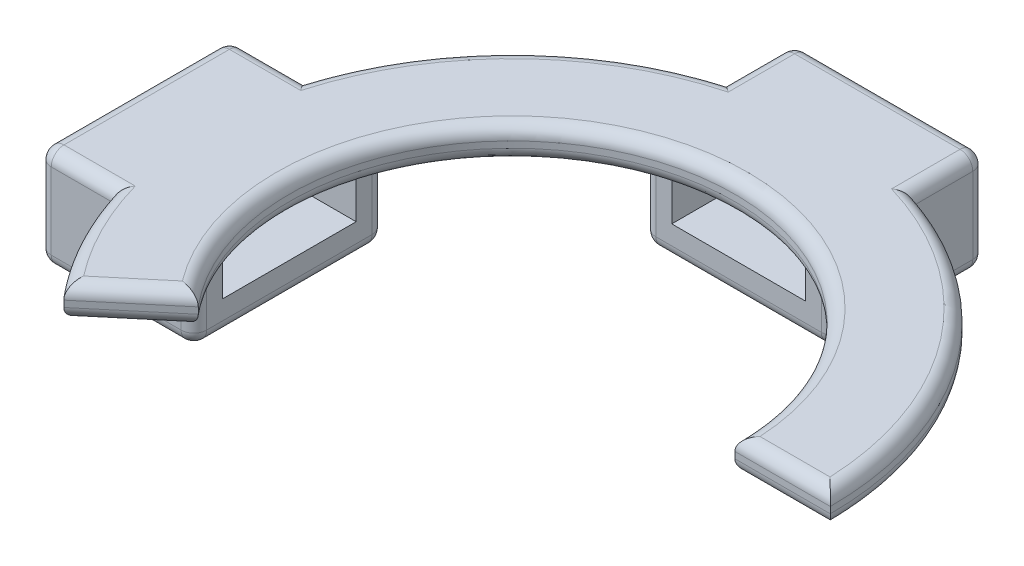
from build123d import *

# Parameters (mm, degrees)
BOSS_EXTRUDE1_DEPTH = 5
BOSS_EXTRUDE2_DEPTH = 5
SKETCH3_W           = 21.364884483
SKETCH3_H           = 30
BOSS_EXTRUDE3_DEPTH = 5
SKETCH4_W           = 4.5
SKETCH4_H           = 23.795279756
SKETCH4_W_2         = 24.409877042
SKETCH4_H_2         = 4.5
BOSS_EXTRUDE4_DEPTH = 11
SKETCH5_W           = 30
SKETCH5_H           = 23.795279756
SKETCH5_W_2         = 24.409877042
SKETCH5_H_2         = 30
BOSS_EXTRUDE5_DEPTH = 5
FILLET1_R           = 2


with BuildPart() as part:
    # Sketch1 → Boss-Extrude1 (new body)
    with BuildSketch(Plane(origin=(0, 0, 0), x_dir=(1, 0, 0), z_dir=(0, 1, 0))):
        with BuildLine():
            Line((-50.590122958, 6.204720244), (-35.590122958, 6.204720244))
            ThreePointArc((-35.590122958, 6.204720244), (-0.590122958, 41.204720244), (34.409877042, 6.204720244))
            Line((34.409877042, 6.204720244), (49.409877042, 6.204720244))
            ThreePointArc((49.409877042, 6.204720244), (-0.590122958, 56.204720244), (-50.590122958, 6.204720244))
        make_face()
        with BuildLine():
            Line((15, 65), (-15, 65))
            Line((-15, 65), (-15, 54.083269132))
            ThreePointArc((-15, 54.083269132), (0.028498674, 56.20089317), (15, 53.71206774))
            Line((15, 53.71206774), (15, 65))
        make_face()
    extrude(amount=BOSS_EXTRUDE1_DEPTH)

    # Sketch2 → Boss-Extrude2 (add)
    with BuildSketch(Plane(origin=(0, 0, 0), x_dir=(1, 0, 0), z_dir=(0, 1, 0))):
        with BuildLine():
            Line((-38.892345114, -25.93466024), (-27.401678467, -16.292846095))
            ThreePointArc((-27.401678467, -16.292846095), (-33.479364685, -5.765984773), (-35.590122958, 6.204720244))
            Line((-35.590122958, 6.204720244), (-50.590122958, 6.204720244))
            ThreePointArc((-50.590122958, 6.204720244), (-47.574753997, -10.896286922), (-38.892345114, -25.93466024))
        make_face()
    extrude(amount=BOSS_EXTRUDE2_DEPTH)

    # Sketch3 → Boss-Extrude3 (add)
    with BuildSketch(Plane(origin=(0, 0, 0), x_dir=(1, 0, 0), z_dir=(0, 1, 0))):
        with Locations((-49.317557759, 6.204720244)):
            Rectangle(SKETCH3_W, SKETCH3_H)
    extrude(amount=BOSS_EXTRUDE3_DEPTH)

    # Sketch4 → Boss-Extrude4 (add)
    with BuildSketch(Plane(origin=(0, 5, 0), x_dir=(1, 0, 0), z_dir=(0, 1, 0))):
        with Locations((-12.75, 53.102360122)):
            Rectangle(SKETCH4_W, SKETCH4_H)
        with Locations((12.75, 53.102360122)):
            Rectangle(SKETCH4_W, SKETCH4_H)
        with Locations((-47.795061479, 18.954720244)):
            Rectangle(SKETCH4_W_2, SKETCH4_H_2)
        with Locations((-47.795061479, -6.545279756)):
            Rectangle(SKETCH4_W_2, SKETCH4_H_2)
    extrude(amount=-BOSS_EXTRUDE4_DEPTH)

    # Sketch5 → Boss-Extrude5 (add)
    with BuildSketch(Plane(origin=(0, -6, 0), x_dir=(-1, 0, 0), z_dir=(0, -1, 0))):
        with Locations((0, 53.102360122)):
            Rectangle(SKETCH5_W, SKETCH5_H)
        with Locations((47.795061479, 6.204720244)):
            Rectangle(SKETCH5_W_2, SKETCH5_H_2)
    extrude(amount=BOSS_EXTRUDE5_DEPTH)

    # Fillet1
    # the kernel refuses this fillet: 2 mm, written as the material it takes off along each edge
    with BuildSketch(Plane(origin=(-37.590122958, -9, -19.204720244), x_dir=(0, 0, -1), z_dir=(1, 0, 0))) as fillet1_piece_1_section:
        Polygon((0, 0), (FILLET1_R * 1.02, 0), (FILLET1_R * 1.02, -FILLET1_R * 1.02), (0, -FILLET1_R * 1.02), align=None)
    fillet1_piece_1 = extrude(amount=FILLET1_R * 1.02, mode=Mode.PRIVATE)
    fillet1_piece_1 = fillet1_piece_1 - Plane(origin=(-37.590122958, -9, -19.204720244), x_dir=(0, 0.7071067811865475, 0.7071067811865475), z_dir=(1, 0, 0)) * Sphere(FILLET1_R, mode=Mode.PRIVATE)
    add(fillet1_piece_1, mode=Mode.SUBTRACT)
    with BuildSketch(Plane(origin=(-37.590122958, -9, 6.795279756), x_dir=(1, 0, 0), z_dir=(0, 0, 1))) as fillet1_piece_2_section:
        Polygon((0, 0), (FILLET1_R * 1.02, 0), (FILLET1_R * 1.02, -FILLET1_R * 1.02), (0, -FILLET1_R * 1.02), align=None)
    fillet1_piece_2 = extrude(amount=FILLET1_R * 1.02, mode=Mode.PRIVATE)
    fillet1_piece_2 = fillet1_piece_2 - Plane(origin=(-37.590122958, -9, 6.795279756), x_dir=(-0.7071067811865475, 0.7071067811865475, 0), z_dir=(0, 0, 1)) * Sphere(FILLET1_R, mode=Mode.PRIVATE)
    add(fillet1_piece_2, mode=Mode.SUBTRACT)
    with BuildSketch(Plane(origin=(-13, -9, -43.204720244), x_dir=(-1, 0, 0), z_dir=(0, 0, 1))) as fillet1_piece_3_section:
        Polygon((0, 0), (FILLET1_R * 1.02, 0), (FILLET1_R * 1.02, FILLET1_R * 1.02), (0, FILLET1_R * 1.02), align=None)
    fillet1_piece_3 = extrude(amount=FILLET1_R * 1.02, mode=Mode.PRIVATE)
    fillet1_piece_3 = fillet1_piece_3 - Plane(origin=(-13, -9, -43.204720244), x_dir=(0.7071067811865475, 0.7071067811865475, 0), z_dir=(0, 0, 1)) * Sphere(FILLET1_R, mode=Mode.PRIVATE)
    add(fillet1_piece_3, mode=Mode.SUBTRACT)
    with BuildSketch(Plane(origin=(-13, -9, -63), x_dir=(0, -1, 0), z_dir=(-1, 0, 0))) as fillet1_piece_4_section:
        Polygon((0, 0), (FILLET1_R * 1.02, 0), (FILLET1_R * 1.02, -FILLET1_R * 1.02), (0, -FILLET1_R * 1.02), align=None)
    fillet1_piece_4 = extrude(amount=FILLET1_R * 1.02, mode=Mode.PRIVATE)
    fillet1_piece_4 = fillet1_piece_4 - Plane(origin=(-13, -9, -63), x_dir=(0, 0.7071067811865475, 0.7071067811865475), z_dir=(-1, 0, 0)) * Sphere(FILLET1_R, mode=Mode.PRIVATE)
    add(fillet1_piece_4, mode=Mode.SUBTRACT)
    with BuildSketch(Plane(origin=(13, -9, -63), x_dir=(1, 0, 0), z_dir=(0, -1, 0))) as fillet1_piece_5_section:
        Polygon((0, 0), (FILLET1_R * 1.02, 0), (FILLET1_R * 1.02, -FILLET1_R * 1.02), (0, -FILLET1_R * 1.02), align=None)
    fillet1_piece_5 = extrude(amount=FILLET1_R * 1.02, mode=Mode.PRIVATE)
    fillet1_piece_5 = fillet1_piece_5 - Plane(origin=(13, -9, -63), x_dir=(-0.7071067811865475, 0, 0.7071067811865475), z_dir=(0, -1, 0)) * Sphere(FILLET1_R, mode=Mode.PRIVATE)
    add(fillet1_piece_5, mode=Mode.SUBTRACT)
    with BuildSketch(Plane(origin=(13, -9, -43.204720244), x_dir=(0, -1, 0), z_dir=(0, 0, 1))) as fillet1_piece_6_section:
        Polygon((0, 0), (FILLET1_R * 1.02, 0), (FILLET1_R * 1.02, FILLET1_R * 1.02), (0, FILLET1_R * 1.02), align=None)
    fillet1_piece_6 = extrude(amount=FILLET1_R * 1.02, mode=Mode.PRIVATE)
    fillet1_piece_6 = fillet1_piece_6 - Plane(origin=(13, -9, -43.204720244), x_dir=(-0.7071067811865475, 0.7071067811865475, 0), z_dir=(0, 0, 1)) * Sphere(FILLET1_R, mode=Mode.PRIVATE)
    add(fillet1_piece_6, mode=Mode.SUBTRACT)
    with BuildSketch(Plane(origin=(-58, -9, 6.795279756), x_dir=(0, -1, 0), z_dir=(0, 0, 1))) as fillet1_piece_7_section:
        Polygon((0, 0), (FILLET1_R * 1.02, 0), (FILLET1_R * 1.02, -FILLET1_R * 1.02), (0, -FILLET1_R * 1.02), align=None)
    fillet1_piece_7 = extrude(amount=FILLET1_R * 1.02, mode=Mode.PRIVATE)
    fillet1_piece_7 = fillet1_piece_7 - Plane(origin=(-58, -9, 6.795279756), x_dir=(0.7071067811865475, 0.7071067811865475, 0), z_dir=(0, 0, 1)) * Sphere(FILLET1_R, mode=Mode.PRIVATE)
    add(fillet1_piece_7, mode=Mode.SUBTRACT)
    with BuildSketch(Plane(origin=(-58, -9, -19.204720244), x_dir=(0, -1, 0), z_dir=(0, 0, -1))) as fillet1_piece_8_section:
        Polygon((0, 0), (FILLET1_R * 1.02, 0), (FILLET1_R * 1.02, FILLET1_R * 1.02), (0, FILLET1_R * 1.02), align=None)
    fillet1_piece_8 = extrude(amount=FILLET1_R * 1.02, mode=Mode.PRIVATE)
    fillet1_piece_8 = fillet1_piece_8 - Plane(origin=(-58, -9, -19.204720244), x_dir=(0.7071067811865475, 0.7071067811865475, 0), z_dir=(0, 0, -1)) * Sphere(FILLET1_R, mode=Mode.PRIVATE)
    add(fillet1_piece_8, mode=Mode.SUBTRACT)
    with BuildSketch(Plane(origin=(-13, 3, -63), x_dir=(0, 0, -1), z_dir=(-1, 0, 0))) as fillet1_piece_9_section:
        Polygon((0, 0), (FILLET1_R * 1.02, 0), (FILLET1_R * 1.02, -FILLET1_R * 1.02), (0, -FILLET1_R * 1.02), align=None)
    fillet1_piece_9 = extrude(amount=FILLET1_R * 1.02, mode=Mode.PRIVATE)
    fillet1_piece_9 = fillet1_piece_9 - Plane(origin=(-13, 3, -63), x_dir=(0, -0.7071067811865475, 0.7071067811865475), z_dir=(-1, 0, 0)) * Sphere(FILLET1_R, mode=Mode.PRIVATE)
    add(fillet1_piece_9, mode=Mode.SUBTRACT)
    with BuildSketch(Plane(origin=(13, 3, -63), x_dir=(0, 0, -1), z_dir=(1, 0, 0))) as fillet1_piece_10_section:
        Polygon((0, 0), (FILLET1_R * 1.02, 0), (FILLET1_R * 1.02, FILLET1_R * 1.02), (0, FILLET1_R * 1.02), align=None)
    fillet1_piece_10 = extrude(amount=FILLET1_R * 1.02, mode=Mode.PRIVATE)
    fillet1_piece_10 = fillet1_piece_10 - Plane(origin=(13, 3, -63), x_dir=(0, -0.7071067811865475, 0.7071067811865475), z_dir=(1, 0, 0)) * Sphere(FILLET1_R, mode=Mode.PRIVATE)
    add(fillet1_piece_10, mode=Mode.SUBTRACT)
    with BuildSketch(Plane(origin=(-58, 3, -19.204720244), x_dir=(0, 0, -1), z_dir=(0, 1, 0))) as fillet1_piece_11_section:
        Polygon((0, 0), (FILLET1_R * 1.02, 0), (FILLET1_R * 1.02, FILLET1_R * 1.02), (0, FILLET1_R * 1.02), align=None)
    fillet1_piece_11 = extrude(amount=FILLET1_R * 1.02, mode=Mode.PRIVATE)
    fillet1_piece_11 = fillet1_piece_11 - Plane(origin=(-58, 3, -19.204720244), x_dir=(0.7071067811865476, 0, 0.7071067811865475), z_dir=(0, 1, 0)) * Sphere(FILLET1_R, mode=Mode.PRIVATE)
    add(fillet1_piece_11, mode=Mode.SUBTRACT)
    with BuildSketch(Plane(origin=(-58, 3, 6.795279756), x_dir=(0, 1, 0), z_dir=(0, 0, 1))) as fillet1_piece_12_section:
        Polygon((0, 0), (FILLET1_R * 1.02, 0), (FILLET1_R * 1.02, FILLET1_R * 1.02), (0, FILLET1_R * 1.02), align=None)
    fillet1_piece_12 = extrude(amount=FILLET1_R * 1.02, mode=Mode.PRIVATE)
    fillet1_piece_12 = fillet1_piece_12 - Plane(origin=(-58, 3, 6.795279756), x_dir=(0.7071067811865475, -0.7071067811865475, 0), z_dir=(0, 0, 1)) * Sphere(FILLET1_R, mode=Mode.PRIVATE)
    add(fillet1_piece_12, mode=Mode.SUBTRACT)
    with BuildSketch(Plane(origin=(-35.590122958, 0, -21.204720244), x_dir=(0, 0, 1), z_dir=(0, -1, 0)), Plane(origin=(15, -9, -41.204720244), x_dir=(0, 0, -1), z_dir=(0, 1, 0))) as fillet1_piece_13:
        with BuildLine():
            CenterArc((FILLET1_R, FILLET1_R), FILLET1_R, 180, 90)
            Line((0, FILLET1_R), (0, 0))
            Line((0, 0), (FILLET1_R, 0))
        make_face()
    extrude(amount=9, mode=Mode.SUBTRACT)
    with BuildSketch(Plane(origin=(-0.590122958, 0, -6.204720244), x_dir=(0.9950016105193895, 0, 0.09985887573881982), z_dir=(-0.09985887573881982, 0, 0.9950016105193895))) as fillet1_piece_14_section:
        with BuildLine():
            CenterArc((50 - FILLET1_R, FILLET1_R), FILLET1_R, 270, 90)
            Line((50 - FILLET1_R, 0), (50, 0))
            Line((50, 0), (50, FILLET1_R))
        make_face()
    fillet1_piece_14 = revolve(axis=Axis((-0.590122958, 0, -6.204720244), (0, 1, 0)), revolution_arc=83.29419928, mode=Mode.PRIVATE)
    fillet1_piece_14 = split(fillet1_piece_14, bisect_by=Plane(origin=(15, 0, -6.204720244), z_dir=(1, 0, 0)), keep=Keep.TOP, mode=Mode.PRIVATE)
    add(fillet1_piece_14, mode=Mode.SUBTRACT)
    with BuildSketch(Plane(origin=(29.409877042, 0, -6.204720244), x_dir=(0, 1, 0), z_dir=(1, 0, 0)), Plane(origin=(-42.722567329, 0, 29.148598289), x_dir=(0, 1, 0), z_dir=(0.7660444431189779, 0, -0.6427876096865396))) as fillet1_piece_15:
        with BuildLine():
            CenterArc((FILLET1_R, -FILLET1_R), FILLET1_R, 90, 90)
            Line((0, -FILLET1_R), (0, 0))
            Line((0, 0), (FILLET1_R, 0))
        make_face()
    extrude(amount=25, mode=Mode.SUBTRACT)
    with BuildSketch(Plane(origin=(-35.590122958, -9, 8.795279756), x_dir=(-1, 0, 0), z_dir=(0, 1, 0)), Plane(origin=(-15, -9, -41.204720244), x_dir=(0, 0, -1), z_dir=(0, 1, 0))) as fillet1_piece_16:
        with BuildLine():
            CenterArc((FILLET1_R, -FILLET1_R), FILLET1_R, 90, 90)
            Line((0, -FILLET1_R), (0, 0))
            Line((0, 0), (FILLET1_R, 0))
        make_face()
    extrude(amount=9, mode=Mode.SUBTRACT)
    with BuildSketch(Plane(origin=(29.409877042, 5, -6.204720244), x_dir=(0, -1, 0), z_dir=(1, 0, 0)), Plane(origin=(-42.722567329, 5, 29.148598289), x_dir=(0, -1, 0), z_dir=(0.7660444431189779, 0, -0.6427876096865396))) as fillet1_piece_17:
        with BuildLine():
            CenterArc((FILLET1_R, FILLET1_R), FILLET1_R, 180, 90)
            Line((0, FILLET1_R), (0, 0))
            Line((0, 0), (FILLET1_R, 0))
        make_face()
    extrude(amount=25, mode=Mode.SUBTRACT)
    with BuildSketch(Plane(origin=(-0.590122958, 0, -6.204720244), x_dir=(0.989764313827561, 0, 0.14271160805434607), z_dir=(-0.14271160805434607, 0, 0.989764313827561))) as fillet1_piece_18_section:
        with BuildLine():
            CenterArc((35 + FILLET1_R, FILLET1_R), FILLET1_R, 180, 90)
            Line((35 + FILLET1_R, 0), (35, 0))
            Line((35, 0), (35, FILLET1_R))
        make_face()
    fillet1_piece_18 = revolve(axis=Axis((-0.590122958, 0, -6.204720244), (0, 1, 0)), revolution_arc=236.409571698, mode=Mode.PRIVATE)
    fillet1_piece_18 = split(fillet1_piece_18, bisect_by=Plane(origin=(-35.590122958, 0, -6.204720244), z_dir=(1, 0, 0)), keep=Keep.TOP, mode=Mode.PRIVATE)
    fillet1_piece_18 = split(fillet1_piece_18, bisect_by=Plane(origin=(-0.590122958, 0, -41.204720244), z_dir=(0, 0, 1)), keep=Keep.TOP, mode=Mode.PRIVATE)
    add(fillet1_piece_18, mode=Mode.SUBTRACT)
    with BuildSketch(Plane(origin=(-0.590122958, 0, -6.204720244), x_dir=(0.989764313827561, 0, 0.14271160805434607), z_dir=(-0.14271160805434607, 0, 0.989764313827561))) as fillet1_piece_19_section:
        with BuildLine():
            CenterArc((35 + FILLET1_R, FILLET1_R), FILLET1_R, 180, 90)
            Line((35 + FILLET1_R, 0), (35, 0))
            Line((35, 0), (35, FILLET1_R))
        make_face()
    fillet1_piece_19 = revolve(axis=Axis((-0.590122958, 0, -6.204720244), (0, 1, 0)), revolution_arc=236.409571698, mode=Mode.PRIVATE)
    fillet1_piece_19 = split(fillet1_piece_19, bisect_by=Plane(origin=(10.5, 0, -6.204720244), z_dir=(-1, 0, 0)), keep=Keep.TOP, mode=Mode.PRIVATE)
    fillet1_piece_19 = split(fillet1_piece_19, bisect_by=Plane(origin=(-10.5, 0, -6.204720244), z_dir=(1, 0, 0)), keep=Keep.TOP, mode=Mode.PRIVATE)
    add(fillet1_piece_19, mode=Mode.SUBTRACT)
    with BuildSketch(Plane(origin=(-0.590122958, 0, -6.204720244), x_dir=(0.989764313827561, 0, 0.14271160805434607), z_dir=(-0.14271160805434607, 0, 0.989764313827561))) as fillet1_piece_20_section:
        with BuildLine():
            CenterArc((35 + FILLET1_R, FILLET1_R), FILLET1_R, 180, 90)
            Line((35 + FILLET1_R, 0), (35, 0))
            Line((35, 0), (35, FILLET1_R))
        make_face()
    fillet1_piece_20 = revolve(axis=Axis((-0.590122958, 0, -6.204720244), (0, 1, 0)), revolution_arc=236.409571698, mode=Mode.PRIVATE)
    fillet1_piece_20 = split(fillet1_piece_20, bisect_by=Plane(origin=(-0.590122958, 0, 4.295279756), z_dir=(0, 0, -1)), keep=Keep.TOP, mode=Mode.PRIVATE)
    fillet1_piece_20 = split(fillet1_piece_20, bisect_by=Plane(origin=(-0.590122958, 0, -16.704720244), z_dir=(0, 0, 1)), keep=Keep.TOP, mode=Mode.PRIVATE)
    add(fillet1_piece_20, mode=Mode.SUBTRACT)
    with BuildSketch(Plane(origin=(-15, -11, -43.204720244), x_dir=(0, 1, 0), z_dir=(0, 0, -1))) as fillet1_piece_21:
        with BuildLine():
            CenterArc((FILLET1_R, FILLET1_R), FILLET1_R, 180, 90)
            Line((0, FILLET1_R), (0, 0))
            Line((0, 0), (FILLET1_R, 0))
        make_face()
    extrude(amount=19.795279756, mode=Mode.SUBTRACT)
    with BuildSketch(Plane(origin=(-13, -11, -65), x_dir=(0, 0, 1), z_dir=(1, 0, 0)), Plane(origin=(13, -11, -41.204720244), x_dir=(0, 0, -1), z_dir=(-1, 0, 0)), Plane(origin=(-60, -11, 6.795279756), x_dir=(1, 0, 0), z_dir=(0, 0, -1))) as fillet1_piece_22:
        with BuildLine():
            CenterArc((FILLET1_R, -FILLET1_R), FILLET1_R, 90, 90)
            Line((0, -FILLET1_R), (0, 0))
            Line((0, 0), (FILLET1_R, 0))
        make_face()
    extrude(amount=26, mode=Mode.SUBTRACT)
    with BuildSketch(Plane(origin=(15, -11, -63), x_dir=(-1, 0, 0), z_dir=(0, 0, 1))) as fillet1_piece_23:
        with BuildLine():
            CenterArc((FILLET1_R, -FILLET1_R), FILLET1_R, 90, 90)
            Line((0, -FILLET1_R), (0, 0))
            Line((0, 0), (FILLET1_R, 0))
        make_face()
    extrude(amount=19.795279756, mode=Mode.SUBTRACT)
    with BuildSketch(Plane(origin=(-58, -11, -21.204720244), x_dir=(0, 0, 1), z_dir=(1, 0, 0))) as fillet1_piece_24:
        with BuildLine():
            CenterArc((FILLET1_R, -FILLET1_R), FILLET1_R, 90, 90)
            Line((0, -FILLET1_R), (0, 0))
            Line((0, 0), (FILLET1_R, 0))
        make_face()
    extrude(amount=20.409877042, mode=Mode.SUBTRACT)
    with BuildSketch(Plane(origin=(-35.590122958, -11, -19.204720244), x_dir=(0, 1, 0), z_dir=(0, 0, 1)), Plane(origin=(13, 5, -65), x_dir=(0, -1, 0), z_dir=(-1, 0, 0)), Plane(origin=(-60, 5, -19.204720244), x_dir=(0, -1, 0), z_dir=(0, 0, 1))) as fillet1_piece_25:
        with BuildLine():
            CenterArc((FILLET1_R, FILLET1_R), FILLET1_R, 180, 90)
            Line((0, FILLET1_R), (0, 0))
            Line((0, 0), (FILLET1_R, 0))
        make_face()
    extrude(amount=26, mode=Mode.SUBTRACT)
    with BuildSketch(Plane(origin=(-37.590122958, -11, 8.795279756), x_dir=(0, 1, 0), z_dir=(-1, 0, 0))) as fillet1_piece_26:
        with BuildLine():
            CenterArc((FILLET1_R, FILLET1_R), FILLET1_R, 180, 90)
            Line((0, FILLET1_R), (0, 0))
            Line((0, 0), (FILLET1_R, 0))
        make_face()
    extrude(amount=20.409877042, mode=Mode.SUBTRACT)
    with BuildSketch(Plane(origin=(-15, 3, -65), x_dir=(0, 0, 1), z_dir=(0, -1, 0)), Plane(origin=(-60, 3, 8.795279756), x_dir=(1, 0, 0), z_dir=(0, -1, 0))) as fillet1_piece_27:
        with BuildLine():
            CenterArc((FILLET1_R, -FILLET1_R), FILLET1_R, 90, 90)
            Line((0, -FILLET1_R), (0, 0))
            Line((0, 0), (FILLET1_R, 0))
        make_face()
    extrude(amount=12, mode=Mode.SUBTRACT)
    with BuildSketch(Plane(origin=(15, 3, -65), x_dir=(0, 0, 1), z_dir=(0, -1, 0)), Plane(origin=(-60, -9, -21.204720244), x_dir=(0, 0, 1), z_dir=(0, 1, 0))) as fillet1_piece_28:
        with BuildLine():
            CenterArc((FILLET1_R, FILLET1_R), FILLET1_R, 180, 90)
            Line((0, FILLET1_R), (0, 0))
            Line((0, 0), (FILLET1_R, 0))
        make_face()
    extrude(amount=12, mode=Mode.SUBTRACT)
    with BuildSketch(Plane(origin=(-0.590122958, 5, -6.204720244), x_dir=(0.9950016105193895, 0, 0.09985887573881982), z_dir=(-0.09985887573881982, 0, 0.9950016105193895))) as fillet1_piece_29_section:
        with BuildLine():
            CenterArc((50 - FILLET1_R, -FILLET1_R), FILLET1_R, 0, 90)
            Line((50 - FILLET1_R, 0), (50, 0))
            Line((50, 0), (50, -FILLET1_R))
        make_face()
    fillet1_piece_29 = revolve(axis=Axis((-0.590122958, 5, -6.204720244), (0, 1, 0)), revolution_arc=83.29419928, mode=Mode.PRIVATE)
    fillet1_piece_29 = split(fillet1_piece_29, bisect_by=Plane(origin=(15, 5, -6.204720244), z_dir=(1, 0, 0)), keep=Keep.TOP, mode=Mode.PRIVATE)
    add(fillet1_piece_29, mode=Mode.SUBTRACT)
    with BuildSketch(Plane(origin=(15, 5, -48.71206774), x_dir=(0, -1, 0), z_dir=(0, 0, -1))) as fillet1_piece_30_section:
        with BuildLine():
            CenterArc((FILLET1_R, FILLET1_R), FILLET1_R, 180, 90)
            Line((0, FILLET1_R), (0, 0))
            Line((0, 0), (FILLET1_R, 0))
        make_face()
    fillet1_piece_30 = extrude(amount=14.28793226, mode=Mode.PRIVATE)
    fillet1_piece_30 = fillet1_piece_30 - Plane(origin=(-0.590122958, 5, -6.204720244), x_dir=(1, 0, 0), z_dir=(0, -1, 0)) * Cylinder(50, 37, mode=Mode.PRIVATE)
    add(fillet1_piece_30, mode=Mode.SUBTRACT)
    with BuildSketch(Plane(origin=(-15, 5, -63), x_dir=(0, -1, 0), z_dir=(0, 0, 1))) as fillet1_piece_31_section:
        with BuildLine():
            CenterArc((FILLET1_R, FILLET1_R), FILLET1_R, 180, 90)
            Line((0, FILLET1_R), (0, 0))
            Line((0, 0), (FILLET1_R, 0))
        make_face()
    fillet1_piece_31 = extrude(amount=13.916730868, mode=Mode.PRIVATE)
    fillet1_piece_31 = fillet1_piece_31 - Plane(origin=(-0.590122958, 5, -6.204720244), x_dir=(1, 0, 0), z_dir=(0, -1, 0)) * Cylinder(50, 36, mode=Mode.PRIVATE)
    add(fillet1_piece_31, mode=Mode.SUBTRACT)
    with BuildSketch(Plane(origin=(-0.590122958, 5, -6.204720244), x_dir=(-0.9791240159485516, 0, 0.2032637729473219), z_dir=(-0.2032637729473219, 0, -0.9791240159485516))) as fillet1_piece_32_section:
        with BuildLine():
            CenterArc((50 - FILLET1_R, -FILLET1_R), FILLET1_R, 0, 90)
            Line((50 - FILLET1_R, 0), (50, 0))
            Line((50, 0), (50, -FILLET1_R))
        make_face()
    fillet1_piece_32 = revolve(axis=Axis((-0.590122958, 5, -6.204720244), (0, 1, 0)), revolution_arc=34.00184149, mode=Mode.PRIVATE)
    fillet1_piece_32 = split(fillet1_piece_32, bisect_by=Plane(origin=(-0.590122958, 5, 8.795279756), z_dir=(0, 0, 1)), keep=Keep.TOP, mode=Mode.PRIVATE)
    add(fillet1_piece_32, mode=Mode.SUBTRACT)
    with BuildSketch(Plane(origin=(-0.590122958, 0, -6.204720244), x_dir=(-0.19114502104221412, 0, -0.9815618069845482), z_dir=(0.9815618069845482, 0, -0.19114502104221412))) as fillet1_piece_33_section:
        with BuildLine():
            CenterArc((50 - FILLET1_R, FILLET1_R), FILLET1_R, 270, 90)
            Line((50 - FILLET1_R, 0), (50, 0))
            Line((50, 0), (50, FILLET1_R))
        make_face()
    fillet1_piece_33 = revolve(axis=Axis((-0.590122958, 0, -6.204720244), (0, 1, 0)), revolution_arc=67.253245318, mode=Mode.PRIVATE)
    fillet1_piece_33 = split(fillet1_piece_33, bisect_by=Plane(origin=(-15, 0, -6.204720244), z_dir=(-1, 0, 0)), keep=Keep.TOP, mode=Mode.PRIVATE)
    fillet1_piece_33 = split(fillet1_piece_33, bisect_by=Plane(origin=(-0.590122958, 0, -21.204720244), z_dir=(0, 0, -1)), keep=Keep.TOP, mode=Mode.PRIVATE)
    add(fillet1_piece_33, mode=Mode.SUBTRACT)
    with BuildSketch(Plane(origin=(-0.590122958, 5, -6.204720244), x_dir=(-0.19114502104221412, 0, -0.9815618069845482), z_dir=(0.9815618069845482, 0, -0.19114502104221412))) as fillet1_piece_34_section:
        with BuildLine():
            CenterArc((50 - FILLET1_R, -FILLET1_R), FILLET1_R, 0, 90)
            Line((50 - FILLET1_R, 0), (50, 0))
            Line((50, 0), (50, -FILLET1_R))
        make_face()
    fillet1_piece_34 = revolve(axis=Axis((-0.590122958, 5, -6.204720244), (0, 1, 0)), revolution_arc=67.253245318, mode=Mode.PRIVATE)
    fillet1_piece_34 = split(fillet1_piece_34, bisect_by=Plane(origin=(-15, 5, -6.204720244), z_dir=(-1, 0, 0)), keep=Keep.TOP, mode=Mode.PRIVATE)
    fillet1_piece_34 = split(fillet1_piece_34, bisect_by=Plane(origin=(-0.590122958, 5, -21.204720244), z_dir=(0, 0, -1)), keep=Keep.TOP, mode=Mode.PRIVATE)
    add(fillet1_piece_34, mode=Mode.SUBTRACT)
    with BuildSketch(Plane(origin=(-43.287083029, 5, 8.795279756), x_dir=(0, -1, 0), z_dir=(-1, 0, 0))) as fillet1_piece_35_section:
        with BuildLine():
            CenterArc((FILLET1_R, -FILLET1_R), FILLET1_R, 90, 90)
            Line((0, -FILLET1_R), (0, 0))
            Line((0, 0), (FILLET1_R, 0))
        make_face()
    fillet1_piece_35 = extrude(amount=14.712916971, mode=Mode.PRIVATE)
    fillet1_piece_35 = fillet1_piece_35 - Plane(origin=(-0.590122958, 5, -6.204720244), x_dir=(1, 0, 0), z_dir=(0, -1, 0)) * Cylinder(50, 38, mode=Mode.PRIVATE)
    add(fillet1_piece_35, mode=Mode.SUBTRACT)
    with BuildSketch(Plane(origin=(-58, 5, -21.204720244), x_dir=(0, 0, 1), z_dir=(1, 0, 0))) as fillet1_piece_36_section:
        with BuildLine():
            CenterArc((FILLET1_R, FILLET1_R), FILLET1_R, 180, 90)
            Line((0, FILLET1_R), (0, 0))
            Line((0, 0), (FILLET1_R, 0))
        make_face()
    fillet1_piece_36 = extrude(amount=14.712916971, mode=Mode.PRIVATE)
    fillet1_piece_36 = fillet1_piece_36 - Plane(origin=(-0.590122958, 5, -6.204720244), x_dir=(1, 0, 0), z_dir=(0, -1, 0)) * Cylinder(50, 38, mode=Mode.PRIVATE)
    add(fillet1_piece_36, mode=Mode.SUBTRACT)
    with BuildSketch(Plane(origin=(-0.590122958, 5, -6.204720244), x_dir=(-0.6664701991892941, 0, 0.7455316717568629), z_dir=(0.7455316717568629, 0, 0.6664701991892941))) as fillet1_piece_37:
        with BuildLine():
            CenterArc((35 + FILLET1_R, FILLET1_R), FILLET1_R, 180, 90)
            Line((35 + FILLET1_R, 0), (35, 0))
            Line((35, 0), (35, FILLET1_R))
        make_face()
    revolve(axis=Axis((-0.590122958, 5, -6.204720244), (0, -1, 0)), revolution_arc=236.409571698, mode=Mode.SUBTRACT)
    with BuildSketch(Plane(origin=(-0.590122958, 0, -6.204720244), x_dir=(-0.9791240159485516, 0, 0.2032637729473219), z_dir=(-0.2032637729473219, 0, -0.9791240159485516))) as fillet1_piece_38_section:
        with BuildLine():
            CenterArc((50 - FILLET1_R, FILLET1_R), FILLET1_R, 270, 90)
            Line((50 - FILLET1_R, 0), (50, 0))
            Line((50, 0), (50, FILLET1_R))
        make_face()
    fillet1_piece_38 = revolve(axis=Axis((-0.590122958, 0, -6.204720244), (0, 1, 0)), revolution_arc=34.00184149, mode=Mode.PRIVATE)
    fillet1_piece_38 = split(fillet1_piece_38, bisect_by=Plane(origin=(-0.590122958, 0, 8.795279756), z_dir=(0, 0, 1)), keep=Keep.TOP, mode=Mode.PRIVATE)
    add(fillet1_piece_38, mode=Mode.SUBTRACT)
    with BuildSketch(Plane(origin=(15, 5, -48.71206774), x_dir=(0, -1, 0), z_dir=(0, 0, -1))) as fillet1_piece_39a_section:
        with BuildLine():
            CenterArc((FILLET1_R, FILLET1_R), FILLET1_R, 180, 90)
            Line((0, FILLET1_R), (0, 0))
            Line((0, 0), (FILLET1_R, 0))
        make_face()
    fillet1_piece_39a = extrude(amount=14.28793226, mode=Mode.PRIVATE)
    fillet1_piece_39a = fillet1_piece_39a & Plane(origin=(-0.590122958, 5, -6.204720244), x_dir=(1, 0, 0), z_dir=(0, -1, 0)) * Cylinder(50, 37, mode=Mode.PRIVATE)
    with BuildSketch(Plane(origin=(-0.590122958, 5, -6.204720244), x_dir=(1, 0, 0), z_dir=(0, 0, 1))) as fillet1_piece_39b_section:
        with BuildLine():
            CenterArc((50 - FILLET1_R, -FILLET1_R), FILLET1_R, 0, 90)
            Line((50 - FILLET1_R, 0), (50, 0))
            Line((50, 0), (50, -FILLET1_R))
        make_face()
    fillet1_piece_39b = revolve(axis=Axis((-0.590122958, 5, -6.204720244), (0, 1, 0)), revolution_arc=77.563155305, mode=Mode.PRIVATE)
    fillet1_piece_39b = split(fillet1_piece_39b, bisect_by=Plane(origin=(15, 5, -6.204720244), z_dir=(-1, 0, 0)), keep=Keep.TOP, mode=Mode.PRIVATE)
    fillet1_piece_39 = fillet1_piece_39a & fillet1_piece_39b
    add(fillet1_piece_39, mode=Mode.SUBTRACT)
    with BuildSketch(Plane(origin=(-0.590122958, 5, -6.204720244), x_dir=(-0.19114502104221412, 0, -0.9815618069845482), z_dir=(0.9815618069845482, 0, -0.19114502104221412))) as fillet1_piece_40a_section:
        with BuildLine():
            CenterArc((50 - FILLET1_R, -FILLET1_R), FILLET1_R, 0, 90)
            Line((50 - FILLET1_R, 0), (50, 0))
            Line((50, 0), (50, -FILLET1_R))
        make_face()
    fillet1_piece_40a = revolve(axis=Axis((-0.590122958, 5, -6.204720244), (0, 1, 0)), revolution_arc=67.253245318, mode=Mode.PRIVATE)
    fillet1_piece_40a = split(fillet1_piece_40a, bisect_by=Plane(origin=(-15, 5, -6.204720244), z_dir=(1, 0, 0)), keep=Keep.TOP, mode=Mode.PRIVATE)
    with BuildSketch(Plane(origin=(-15, 5, -63), x_dir=(0, -1, 0), z_dir=(0, 0, 1))) as fillet1_piece_40b_section:
        with BuildLine():
            CenterArc((FILLET1_R, FILLET1_R), FILLET1_R, 180, 90)
            Line((0, FILLET1_R), (0, 0))
            Line((0, 0), (FILLET1_R, 0))
        make_face()
    fillet1_piece_40b = extrude(amount=13.916730868, mode=Mode.PRIVATE)
    fillet1_piece_40b = fillet1_piece_40b & Plane(origin=(-0.590122958, 5, -6.204720244), x_dir=(1, 0, 0), z_dir=(0, -1, 0)) * Cylinder(50, 36, mode=Mode.PRIVATE)
    fillet1_piece_40 = fillet1_piece_40a & fillet1_piece_40b
    add(fillet1_piece_40, mode=Mode.SUBTRACT)
    with BuildSketch(Plane(origin=(-0.590122958, 5, -6.204720244), x_dir=(-0.9791240159485516, 0, 0.2032637729473219), z_dir=(-0.2032637729473219, 0, -0.9791240159485516))) as fillet1_piece_41a_section:
        with BuildLine():
            CenterArc((50 - FILLET1_R, -FILLET1_R), FILLET1_R, 0, 90)
            Line((50 - FILLET1_R, 0), (50, 0))
            Line((50, 0), (50, -FILLET1_R))
        make_face()
    fillet1_piece_41a = revolve(axis=Axis((-0.590122958, 5, -6.204720244), (0, 1, 0)), revolution_arc=28.272119183, mode=Mode.PRIVATE)
    fillet1_piece_41a = split(fillet1_piece_41a, bisect_by=Plane(origin=(-0.590122958, 5, 8.795279756), z_dir=(0, 0, -1)), keep=Keep.TOP, mode=Mode.PRIVATE)
    with BuildSketch(Plane(origin=(-43.287083029, 5, 8.795279756), x_dir=(0, -1, 0), z_dir=(-1, 0, 0))) as fillet1_piece_41b_section:
        with BuildLine():
            CenterArc((FILLET1_R, -FILLET1_R), FILLET1_R, 90, 90)
            Line((0, -FILLET1_R), (0, 0))
            Line((0, 0), (FILLET1_R, 0))
        make_face()
    fillet1_piece_41b = extrude(amount=14.712916971, mode=Mode.PRIVATE)
    fillet1_piece_41b = fillet1_piece_41b & Plane(origin=(-0.590122958, 5, -6.204720244), x_dir=(1, 0, 0), z_dir=(0, -1, 0)) * Cylinder(50, 38, mode=Mode.PRIVATE)
    fillet1_piece_41 = fillet1_piece_41a & fillet1_piece_41b
    add(fillet1_piece_41, mode=Mode.SUBTRACT)
    with BuildSketch(Plane(origin=(-0.590122958, 5, -6.204720244), x_dir=(-0.19114502104221412, 0, -0.9815618069845482), z_dir=(0.9815618069845482, 0, -0.19114502104221412))) as fillet1_piece_42a_section:
        with BuildLine():
            CenterArc((50 - FILLET1_R, -FILLET1_R), FILLET1_R, 0, 90)
            Line((50 - FILLET1_R, 0), (50, 0))
            Line((50, 0), (50, -FILLET1_R))
        make_face()
    fillet1_piece_42a = revolve(axis=Axis((-0.590122958, 5, -6.204720244), (0, 1, 0)), revolution_arc=67.253245318, mode=Mode.PRIVATE)
    fillet1_piece_42a = split(fillet1_piece_42a, bisect_by=Plane(origin=(-0.590122958, 5, -21.204720244), z_dir=(0, 0, 1)), keep=Keep.TOP, mode=Mode.PRIVATE)
    with BuildSketch(Plane(origin=(-58, 5, -21.204720244), x_dir=(0, 0, 1), z_dir=(1, 0, 0))) as fillet1_piece_42b_section:
        with BuildLine():
            CenterArc((FILLET1_R, FILLET1_R), FILLET1_R, 180, 90)
            Line((0, FILLET1_R), (0, 0))
            Line((0, 0), (FILLET1_R, 0))
        make_face()
    fillet1_piece_42b = extrude(amount=14.712916971, mode=Mode.PRIVATE)
    fillet1_piece_42b = fillet1_piece_42b & Plane(origin=(-0.590122958, 5, -6.204720244), x_dir=(1, 0, 0), z_dir=(0, -1, 0)) * Cylinder(50, 38, mode=Mode.PRIVATE)
    fillet1_piece_42 = fillet1_piece_42a & fillet1_piece_42b
    add(fillet1_piece_42, mode=Mode.SUBTRACT)


solid = part.part
